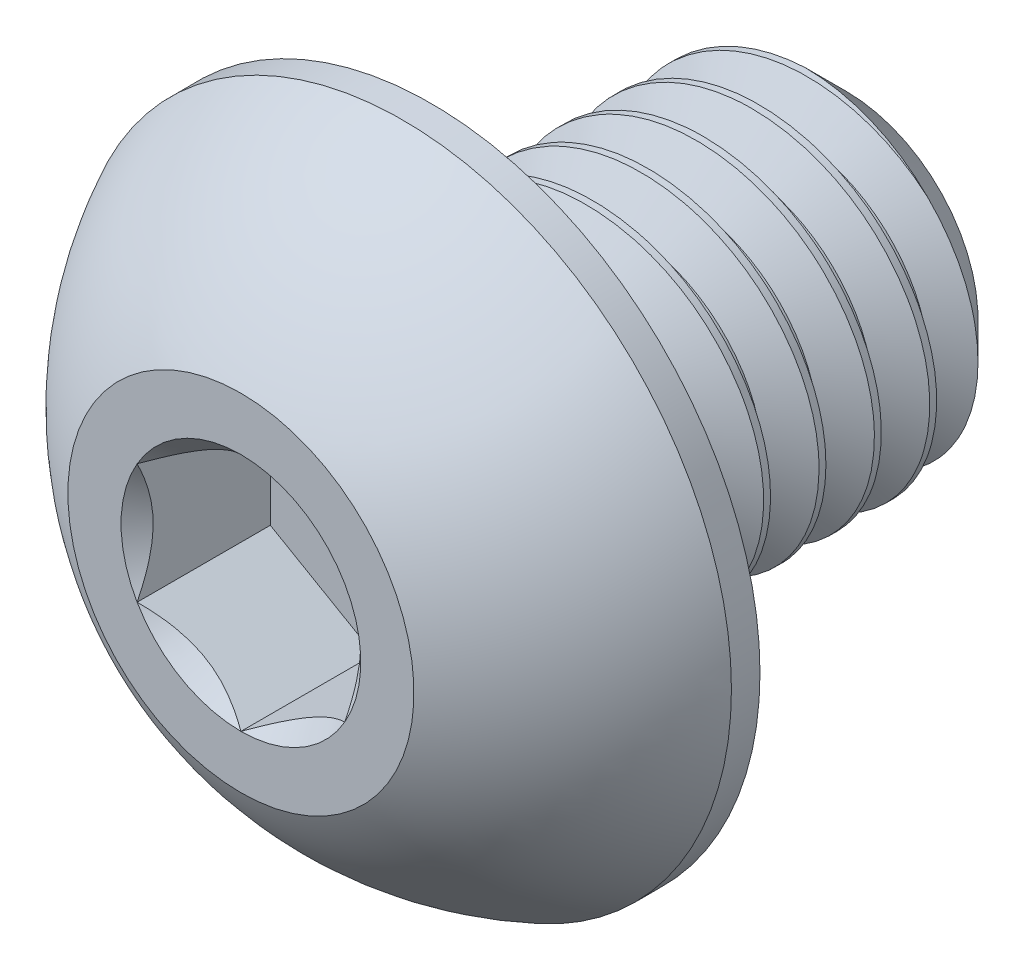
from build123d import *

# Parameters (mm, degrees)
SKETCH1_W          = 6
SKETCH1_H          = 2.5
CHAMFER1_SIZE      = 0.6
CUT_EXTRUDE2_DEPTH = 1.925
CUT_SWEEP1_PITCH   = 0.8


with BuildPart() as part:
    # Sketch1 → Revolve1 (revolve)
    with BuildSketch(Plane(origin=(0, 0, 0), x_dir=(0, 0, -1), z_dir=(1, 0, 0))):
        with Locations((5.75, 1.25)):
            Rectangle(SKETCH1_W, SKETCH1_H)
    revolve(axis=Axis((0, 0, -8.75), (0, 0, 1)))

    # Chamfer1
    chamfer1_edges = [part.edges().sort_by_distance(p)[0] for p in [
        (0, -2.5, -8.75),
    ]]
    chamfer(chamfer1_edges, length=CHAMFER1_SIZE)

    # Sketch7 → Revolve2 (revolve)
    with BuildSketch(Plane(origin=(0, 0, 0), x_dir=(0, 0, -1), z_dir=(1, 0, 0)), mode=Mode.PRIVATE) as revolve2_sk:
        with BuildLine():
            Line((2.3375, 4.75), (2.75, 4.75))
            Line((2.75, 4.75), (2.75, 0))
            Line((2.75, 0), (0, 0))
            Line((0, 0), (0, 2.5))
            ThreePointArc((0, 2.5), (0.991875183, 3.808753282), (2.3375, 4.75))
        make_face()
    revolve(revolve2_sk.sketch.rotate(Axis((0, 0, 0), (0, 0, -1)), 180), axis=Axis((0, 0, 0), (0, 0, -1)))

    # Sketch5 → Cut-Extrude2 (cut)
    with BuildSketch(Plane.XY):
        Polygon((1.5, -0.866025404), (1.5, 0.866025404), (0, 1.732050808), (-1.5, 0.866025404), (-1.5, -0.866025404), (0, -1.732050808), align=None)
    extrude(amount=-CUT_EXTRUDE2_DEPTH, mode=Mode.SUBTRACT)

    # Cut-Extrude3 cone 1 section (through the dimple's axis) → Cut-Extrude3 (revolve, cut)
    with BuildSketch(Plane(origin=(0, 0, 0), x_dir=(0, -1, 0), z_dir=(1, 0, 0))):
        Polygon((0, 0), (1.732050808, 0), (0, 1.732050808), align=None)
    revolve(axis=Axis((0, 0, 0), (0, 0, -1)), mode=Mode.SUBTRACT)

    # Cut-Sweep1: the profile of Sketch2 profile screwed along a right-hand helix of 8.5 turns, 8 arcs to a turn; built about Z, then put on its axis
    cut_sweep1_z = Axis((0, 0, 0), (0, 0, 1))
    cut_sweep1_corners = [(2.5003, 0, 0.600173205), (2.5003, 0, -0.100173205), (1.980384758, 0, 0.2), (1.980384758, 0, 0.3)]
    with BuildLine(mode=Mode.PRIVATE) as cut_sweep1_profile:
        Line(cut_sweep1_corners[0], cut_sweep1_corners[1])
        Line(cut_sweep1_corners[1], cut_sweep1_corners[2])
        Line(cut_sweep1_corners[2], cut_sweep1_corners[3])
        Line(cut_sweep1_corners[3], cut_sweep1_corners[0])
    cut_sweep1_cap = Face(cut_sweep1_profile.wire())
    cut_sweep1_turn_angles = [0, 22.5, 45, 67.5, 90, 112.5, 135, 157.5, 180, 202.5, 225, 247.5, 270, 292.5, 315, 337.5, 360]
    cut_sweep1_turn_weights = [1, 0.9238795325112867, 1, 0.9238795325112867, 1, 0.9238795325112867, 1, 0.9238795325112867, 1, 0.9238795325112867, 1, 0.9238795325112867, 1, 0.9238795325112867, 1, 0.9238795325112867, 1]
    cut_sweep1_turn_rails = [Edge.make_bspline([Vector(p[0], p[1], 0).rotate(cut_sweep1_z, cut_sweep1_turn_angles[k]) / cut_sweep1_turn_weights[k] + Vector(0, 0, p[2] + CUT_SWEEP1_PITCH * cut_sweep1_turn_angles[k] / 360) for k in range(17)], [0, 0, 0, 1, 1, 2, 2, 3, 3, 4, 4, 5, 5, 6, 6, 7, 7, 8, 8, 8], 2, cut_sweep1_turn_weights) for p in cut_sweep1_corners]
    cut_sweep1_turn_sides = [Face.make_surface_from_curves(cut_sweep1_turn_rails[p[0]], cut_sweep1_turn_rails[p[1]]) for p in [(0, 1), (1, 2), (2, 3), (3, 0)]]
    cut_sweep1_last_angles = [2880, 2902.5, 2925, 2947.5, 2970, 2992.5, 3015, 3037.5, 3060]
    cut_sweep1_last_weights = [1, 0.9238795325112867, 1, 0.9238795325112867, 1, 0.9238795325112867, 1, 0.9238795325112852, 1]
    cut_sweep1_last_rails = [Edge.make_bspline([Vector(p[0], p[1], 0).rotate(cut_sweep1_z, cut_sweep1_last_angles[k]) / cut_sweep1_last_weights[k] + Vector(0, 0, p[2] + CUT_SWEEP1_PITCH * cut_sweep1_last_angles[k] / 360) for k in range(9)], [0, 0, 0, 1, 1, 2, 2, 3, 3, 4, 4, 4], 2, cut_sweep1_last_weights) for p in cut_sweep1_corners]
    cut_sweep1_last_sides = [Face.make_surface_from_curves(cut_sweep1_last_rails[p[0]], cut_sweep1_last_rails[p[1]]) for p in [(0, 1), (1, 2), (2, 3), (3, 0)]]
    cut_sweep1 = Plane(origin=(0, 0, -8.75), x_dir=(0, 1, 0), z_dir=(0, 0, 1)) * Solid(Shell([*[p.moved(Location((0, 0, CUT_SWEEP1_PITCH * i))) for i in range(8) for p in cut_sweep1_turn_sides], *cut_sweep1_last_sides, cut_sweep1_cap, cut_sweep1_cap.rotate(cut_sweep1_z, 3060).moved(Location((0, 0, CUT_SWEEP1_PITCH * 3060 / 360)))]))
    add(cut_sweep1, mode=Mode.SUBTRACT)


solid = part.part
